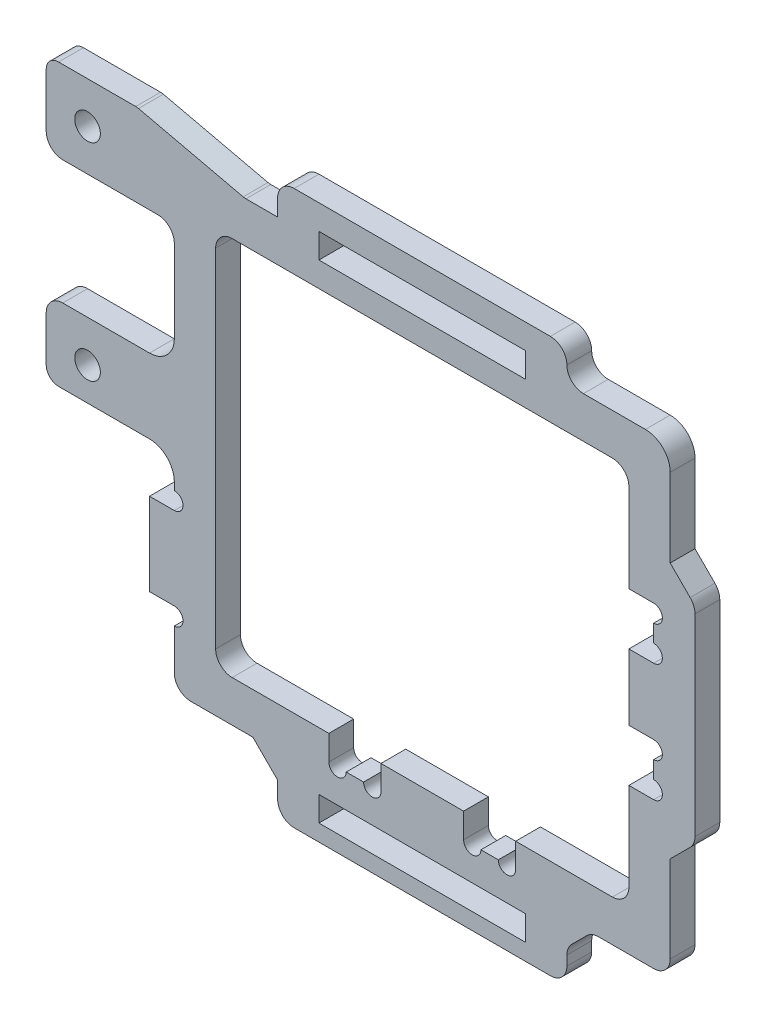
from build123d import *

# Parameters (mm, degrees)
SKETCH_1_W      = 25
SKETCH_1_H      = 3
SKETCH_1_R      = 1.55
EXTRUDE_1_DEPTH = 3
FILLET_2_R      = 3
FILLET_4_R      = 2
FILLET_5_R      = 1.5
FILLET_6_R      = 3
FILLET_1_R      = 2


with BuildPart() as part:
    # 草图1 → 凸台-拉伸1 (new body)
    with BuildSketch(Plane.XY):
        with BuildLine():
            Line((-34.5, 31), (-45.5, 31))
            Line((-45.5, 31), (-45.5, 21))
            Line((-45.5, 21), (-30, 21))
            Line((-30, 21), (-30, 6))
            Line((-30, 6), (-45.5, 6))
            Line((-45.5, 6), (-45.5, -3))
            Line((-45.5, -3), (-30, -3))
            Line((-30, -3), (-30, -6.9))
            ThreePointArc((-30, -6.9), (-28.95, -7.95), (-30, -9))
            Line((-30, -9), (-33, -9))
            Line((-33, -9), (-33, -19))
            Line((-33, -19), (-30, -19))
            ThreePointArc((-30, -19), (-28.95, -20.05), (-30, -21.1))
            Line((-30, -21.1), (-30, -28))
            Line((-30, -28), (-20.5, -28))
            Line((-20.5, -28), (-17.5, -31))
            Line((-17.5, -31), (-17.5, -35))
            Line((-17.5, -35), (17.5, -35))
            Line((17.5, -35), (17.5, -31))
            Line((17.5, -31), (20.5, -28))
            Line((20.5, -28), (30, -28))
            Line((30, -28), (30, -15.5))
            Line((30, -15.5), (33, -12.5))
            Line((33, -12.5), (33, 12.5))
            Line((33, 12.5), (30, 15.5))
            Line((30, 15.5), (30, 28))
            Line((30, 28), (17.5, 28))
            Line((17.5, 28), (17.5, 32))
            Line((17.5, 32), (-17.5, 32))
            Line((-17.5, 32), (-17.5, 28))
            Line((-17.5, 28), (-21.5, 28))
            Line((-21.5, 28), (-34.5, 31))
        make_face()
        with Locations((0, -31.5)):
            Rectangle(SKETCH_1_W, SKETCH_1_H, mode=Mode.SUBTRACT)
        with BuildLine():
            Line((25, -10.3), (25, -23))
            Line((25, -23), (11.3, -23))
            Line((11.3, -23), (11.3, -26))
            ThreePointArc((11.3, -26), (10.25, -27.05), (9.2, -26))
            Line((9.2, -26), (7.1, -26))
            ThreePointArc((7.1, -26), (6.05, -27.05), (5, -26))
            Line((5, -26), (5, -23))
            Line((5, -23), (-5, -23))
            Line((-5, -23), (-5, -26))
            ThreePointArc((-5, -26), (-6.05, -27.05), (-7.1, -26))
            Line((-7.1, -26), (-9.2, -26))
            ThreePointArc((-9.2, -26), (-10.25, -27.05), (-11.3, -26))
            Line((-11.3, -26), (-11.3, -23))
            Line((-11.3, -23), (-25, -23))
            Line((-25, -23), (-25, 23))
            Line((-25, 23), (25, 23))
            Line((25, 23), (25, 10.3))
            Line((25, 10.3), (28, 10.3))
            ThreePointArc((28, 10.3), (29.05, 9.25), (28, 8.2))
            Line((28, 8.2), (28, 6.1))
            ThreePointArc((28, 6.1), (29.05, 5.05), (28, 4))
            Line((28, 4), (25, 4))
            Line((25, 4), (25, -4))
            Line((25, -4), (28, -4))
            ThreePointArc((28, -4), (29.05, -5.05), (28, -6.1))
            Line((28, -6.1), (28, -8.2))
            ThreePointArc((28, -8.2), (29.05, -9.25), (28, -10.3))
            Line((28, -10.3), (25, -10.3))
        make_face(mode=Mode.SUBTRACT)
        with Locations((-40.5, 1)):
            Circle(SKETCH_1_R, mode=Mode.SUBTRACT)
        with Locations((-40.5, 26)):
            Circle(SKETCH_1_R, mode=Mode.SUBTRACT)
        with Locations((0, 27.5)):
            Rectangle(SKETCH_1_W, SKETCH_1_H, mode=Mode.SUBTRACT)
    extrude(amount=EXTRUDE_1_DEPTH)

    # 圆角2
    fillet_2_edges = [part.edges().sort_by_distance(p)[0] for p in [
        (30, 28, 1.5),
    ]]
    fillet(fillet_2_edges, radius=FILLET_2_R)

    # 圆角4
    fillet_4_edges = [part.edges().sort_by_distance(p)[0] for p in [
        (-30, 21, 1.5),
    ]]
    fillet(fillet_4_edges, radius=FILLET_4_R)

    # 圆角5
    fillet_5_edges = [part.edges().sort_by_distance(p)[0] for p in [
        (-45.5, -3, 1.5),
        (-45.5, 31, 1.5),
        (-34.5, 31, 1.5),
        (-21.5, 28, 1.5),
    ]]
    fillet(fillet_5_edges, radius=FILLET_5_R)

    # 圆角6
    fillet_6_edges = [part.edges().sort_by_distance(p)[0] for p in [
        (-30, -3, 1.5),
        (-30, 6, 1.5),
    ]]
    fillet(fillet_6_edges, radius=FILLET_6_R)

    # 圆角1
    fillet_1_edges = [part.edges().sort_by_distance(p)[0] for p in [
        (25, 23, 1.5),
        (-25, 23, 1.5),
        (-25, -23, 1.5),
        (25, -23, 1.5),
        (-45.5, 6, 1.5),
        (-45.5, 21, 1.5),
        (-17.5, 32, 1.5),
        (17.5, 32, 1.5),
        (17.5, 28, 1.5),
        (33, 12.5, 1.5),
        (33, -12.5, 1.5),
        (30, -28, 1.5),
        (20.5, -28, 1.5),
        (17.5, -31, 1.5),
        (17.5, -35, 1.5),
        (-17.5, -35, 1.5),
        (-30, -28, 1.5),
    ]]
    fillet(fillet_1_edges, radius=FILLET_1_R - 0.0001)  # a hair under: the kernel refuses the full size


solid = part.part
